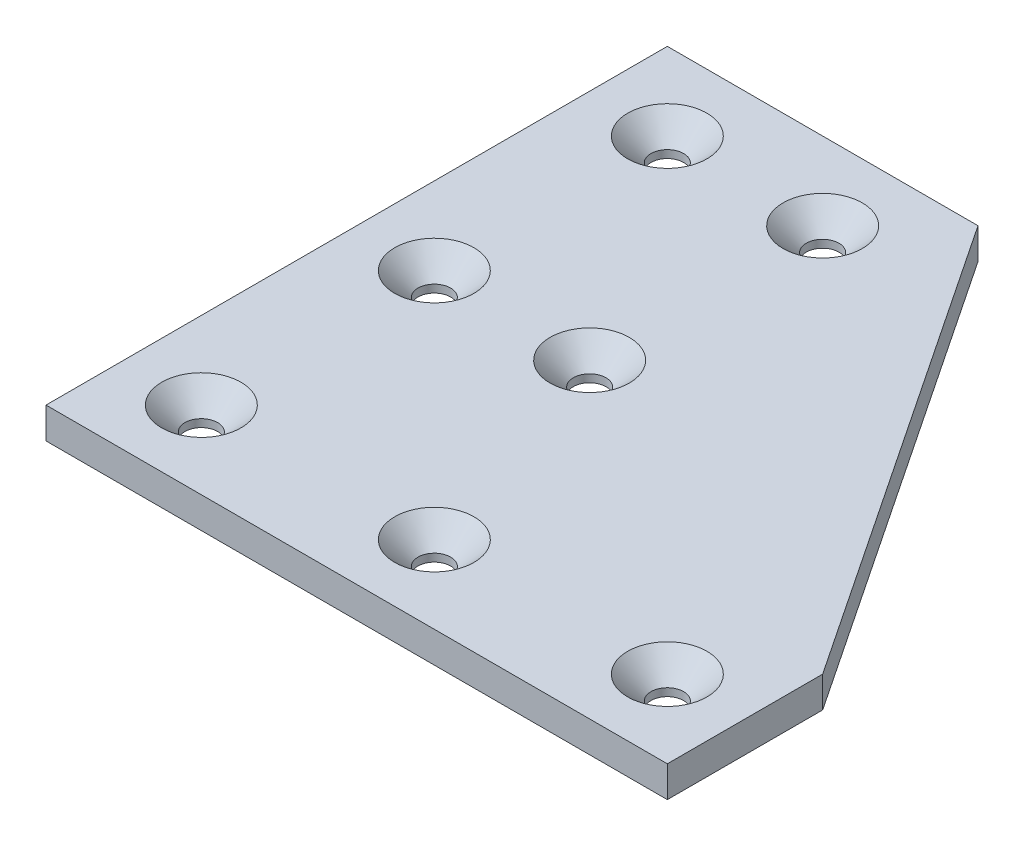
from build123d import *

# Parameters (mm, degrees)
BOSS_EXTRUDE1_DEPTH = 4
SKETCH2_R           = 2.1
CUT_EXTRUDE1_DEPTH  = 4
CHAMFER1_SIZE       = 3


with BuildPart() as part:
    # Sketch1 → Boss-Extrude1 (new body)
    with BuildSketch(Plane(origin=(0, 0, 0), x_dir=(1, 0, 0), z_dir=(0, 1, 0))):
        Polygon((0, 0), (80, 0), (80, 20), (40, 80), (0, 80), align=None)
    extrude(amount=BOSS_EXTRUDE1_DEPTH)

    # Sketch2 → Cut-Extrude1 (cut)
    with BuildSketch(Plane(origin=(0, 4, 0), x_dir=(1, 0, 0), z_dir=(0, 1, 0))):
        with Locations((10, 10)):
            Circle(SKETCH2_R)
        with Locations((40, 10)):
            Circle(SKETCH2_R)
        with Locations((70, 10)):
            Circle(SKETCH2_R)
        with Locations((30, 40)):
            Circle(SKETCH2_R)
        with Locations((30, 70)):
            Circle(SKETCH2_R)
        with Locations((10, 40)):
            Circle(SKETCH2_R)
        with Locations((10, 70)):
            Circle(SKETCH2_R)
    extrude(amount=-CUT_EXTRUDE1_DEPTH, mode=Mode.SUBTRACT)

    # Chamfer1
    chamfer1_edges = [part.edges().sort_by_distance(p)[0] for p in [
        (67.9, 4, -10),
        (37.9, 4, -10),
        (7.9, 4, -10),
        (27.9, 4, -40),
        (7.9, 4, -40),
        (27.9, 4, -70),
        (7.9, 4, -70),
    ]]
    chamfer(chamfer1_edges, length=CHAMFER1_SIZE)


solid = part.part
